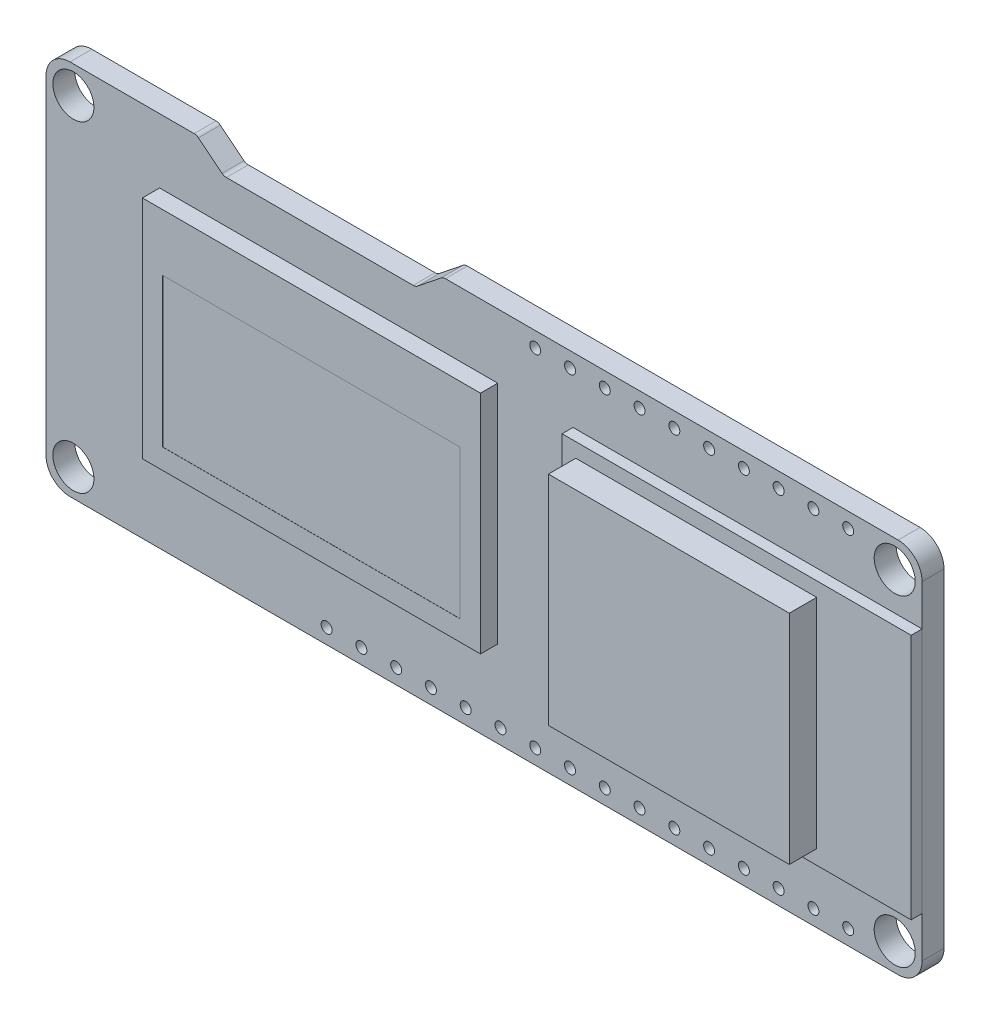
from build123d import *

# Parameters (mm, degrees)
ESQUISSE1_R             = 1.5
ESQUISSE1_R_2           = 0.4
BOSS_EXTRU_1_DEPTH      = 1.6
ESQUISSE2_W             = 25.5
ESQUISSE2_H             = 18
BOSS_EXTRU_2_DEPTH      = 0.8
ESQUISSE3_W             = 17.6
ESQUISSE3_H             = 15.9
BOSS_EXTRU_3_DEPTH      = 2
ESQUISSE4_W             = 24.7
ESQUISSE4_H             = 16.5
BOSS_EXTRU_4_DEPTH      = 1.26
ESQUISSE5_W             = 21.74
ESQUISSE5_H             = 10.86
ENL_V_MAT_EXTRU_1_DEPTH = 0.1
D_PLACER_LA_FACE2_BY    = 0.09
ESQUISSE7_W             = 5.8
ESQUISSE7_H             = 8
BOSS_EXTRU_5_DEPTH      = 2.6
ESQUISSE8_W             = 2.8
ESQUISSE8_H             = 8
BOSS_EXTRU_6_DEPTH      = 0.8
CONG_1_R                = 0.66
ESQUISSE9_W             = 0.5
ESQUISSE9_H             = 4
ENL_V_MAT_EXTRU_2_DEPTH = 5
ESQUISSE10_W            = 3
ESQUISSE10_H            = 4
BOSS_EXTRU_7_DEPTH      = 1.8
ESQUISSE11_R            = 0.9
BOSS_EXTRU_8_DEPTH      = 0.5
BOSS_EXTRU_9_DEPTH      = 2
ESQUISSE12_W            = 11.5
ESQUISSE12_H            = 11
BOSS_EXTRU_9_2_DEPTH    = 2


with BuildPart() as part:
    # Esquisse1 → Boss.-Extru.1 (new body)
    with BuildSketch(Plane.XY):
        with BuildLine():
            Line((-20.863043006, 13.640434405), (-19.136956994, 12.259565595))
            ThreePointArc((-19.136956994, 12.259565595), (-18.990112941, 12.17818584), (-18.82460947, 12.15))
            Line((-18.82460947, 12.15), (-5.17539053, 12.15))
            ThreePointArc((-5.17539053, 12.15), (-5.009887059, 12.17818584), (-4.863043006, 12.259565595))
            Line((-4.863043006, 12.259565595), (-3.136956994, 13.640434405))
            ThreePointArc((-3.136956994, 13.640434405), (-2.990112941, 13.72181416), (-2.82460947, 13.75))
            Line((-2.82460947, 13.75), (30.25, 13.75))
            ThreePointArc((30.25, 13.75), (31.487436867, 13.237436867), (32, 12))
            Line((32, 12), (32, -12))
            ThreePointArc((32, -12), (31.487436867, -13.237436867), (30.25, -13.75))
            Line((30.25, -13.75), (-30.25, -13.75))
            ThreePointArc((-30.25, -13.75), (-31.487436867, -13.237436867), (-32, -12))
            Line((-32, -12), (-32, 12))
            ThreePointArc((-32, 12), (-31.487436867, 13.237436867), (-30.25, 13.75))
            Line((-30.25, 13.75), (-21.17539053, 13.75))
            ThreePointArc((-21.17539053, 13.75), (-21.009887059, 13.72181416), (-20.863043006, 13.640434405))
        make_face()
        with Locations((30, 11.75)):
            Circle(ESQUISSE1_R, mode=Mode.SUBTRACT)
        with Locations((30, -11.75)):
            Circle(ESQUISSE1_R, mode=Mode.SUBTRACT)
        with Locations((-30, -11.75)):
            Circle(ESQUISSE1_R, mode=Mode.SUBTRACT)
        with Locations((-30, 11.75)):
            Circle(ESQUISSE1_R, mode=Mode.SUBTRACT)
        with Locations((26.6, 12.65)):
            Circle(ESQUISSE1_R_2, mode=Mode.SUBTRACT)
        with Locations((24.06, 12.65)):
            Circle(ESQUISSE1_R_2, mode=Mode.SUBTRACT)
        with Locations((21.52, 12.65)):
            Circle(ESQUISSE1_R_2, mode=Mode.SUBTRACT)
        with Locations((18.98, 12.65)):
            Circle(ESQUISSE1_R_2, mode=Mode.SUBTRACT)
        with Locations((16.44, 12.65)):
            Circle(ESQUISSE1_R_2, mode=Mode.SUBTRACT)
        with Locations((13.9, 12.65)):
            Circle(ESQUISSE1_R_2, mode=Mode.SUBTRACT)
        with Locations((11.36, 12.65)):
            Circle(ESQUISSE1_R_2, mode=Mode.SUBTRACT)
        with Locations((8.82, 12.65)):
            Circle(ESQUISSE1_R_2, mode=Mode.SUBTRACT)
        with Locations((6.28, 12.65)):
            Circle(ESQUISSE1_R_2, mode=Mode.SUBTRACT)
        with Locations((3.74, 12.65)):
            Circle(ESQUISSE1_R_2, mode=Mode.SUBTRACT)
        with Locations(Location((26.6, -12.65, 0), (0, 0, 180))):
            Circle(ESQUISSE1_R_2, mode=Mode.SUBTRACT)
        with Locations(Location((24.06, -12.65, 0), (0, 0, 180))):
            Circle(ESQUISSE1_R_2, mode=Mode.SUBTRACT)
        with Locations(Location((21.52, -12.65, 0), (0, 0, 180))):
            Circle(ESQUISSE1_R_2, mode=Mode.SUBTRACT)
        with Locations(Location((18.98, -12.65, 0), (0, 0, 180))):
            Circle(ESQUISSE1_R_2, mode=Mode.SUBTRACT)
        with Locations(Location((16.44, -12.65, 0), (0, 0, 180))):
            Circle(ESQUISSE1_R_2, mode=Mode.SUBTRACT)
        with Locations(Location((13.9, -12.65, 0), (0, 0, 180))):
            Circle(ESQUISSE1_R_2, mode=Mode.SUBTRACT)
        with Locations(Location((11.36, -12.65, 0), (0, 0, 180))):
            Circle(ESQUISSE1_R_2, mode=Mode.SUBTRACT)
        with Locations(Location((8.82, -12.65, 0), (0, 0, 180))):
            Circle(ESQUISSE1_R_2, mode=Mode.SUBTRACT)
        with Locations(Location((6.28, -12.65, 0), (0, 0, 180))):
            Circle(ESQUISSE1_R_2, mode=Mode.SUBTRACT)
        with Locations(Location((3.74, -12.65, 0), (0, 0, 180))):
            Circle(ESQUISSE1_R_2, mode=Mode.SUBTRACT)
        with Locations(Location((1.2, -12.65, 0), (0, 0, 180))):
            Circle(ESQUISSE1_R_2, mode=Mode.SUBTRACT)
        with Locations(Location((-1.34, -12.65, 0), (0, 0, 180))):
            Circle(ESQUISSE1_R_2, mode=Mode.SUBTRACT)
        with Locations(Location((-3.88, -12.65, 0), (0, 0, 180))):
            Circle(ESQUISSE1_R_2, mode=Mode.SUBTRACT)
        with Locations(Location((-6.42, -12.65, 0), (0, 0, 180))):
            Circle(ESQUISSE1_R_2, mode=Mode.SUBTRACT)
        with Locations(Location((-8.96, -12.65, 0), (0, 0, 180))):
            Circle(ESQUISSE1_R_2, mode=Mode.SUBTRACT)
        with Locations(Location((-11.5, -12.65, 0), (0, 0, 180))):
            Circle(ESQUISSE1_R_2, mode=Mode.SUBTRACT)
    extrude(amount=-BOSS_EXTRU_1_DEPTH)

    # Esquisse7 → Boss.-Extru.5 (add)
    with BuildSketch(Plane(origin=(0, 0, -1.6), x_dir=(-1, 0, 0), z_dir=(0, 0, -1))):
        with Locations((29.1, -4.55)):
            Rectangle(ESQUISSE7_W, ESQUISSE7_H)
    extrude(amount=BOSS_EXTRU_5_DEPTH)

    # Esquisse8 → Boss.-Extru.6 (add)
    with BuildSketch(Plane.ZY.offset(32)):
        with Locations((-2.8, -4.55)):
            Rectangle(ESQUISSE8_W, ESQUISSE8_H)
    extrude(amount=BOSS_EXTRU_6_DEPTH)

    # Congé1
    cong_1_edges = [part.edges().sort_by_distance(p)[0] for p in [
        (-29.5, -0.55, -4.2),
        (-29.5, -8.55, -4.2),
    ]]
    fillet(cong_1_edges, radius=CONG_1_R)

    # Chanfrein1
    # the kernel refuses this chamfer: 1 mm, written as the material it takes off along each edge
    with BuildSketch(Plane(origin=(-25.827960829, -0.55, -1.4), x_dir=(0, -0.9996219169112968, 0.027495876610586282), z_dir=(-1, 0, 0))) as chanfrein1_piece_1_section:
        with BuildLine():
            Line((1.028673195, 0), (-0.056547155, -1.027117794))
            Line((-0.056547155, -1.027117794), (-0.076539593, -1.026567876))
            ThreePointArc((-0.076539593, -1.026567876), (-0.034129227, -0.51339783), (-0.019992438, 0.000549918))
            Line((-0.019992438, 0.000549918), (0.000549918, 0.019992438))
            ThreePointArc((0.000549918, 0.019992438), (0.514497665, 0.00585565), (1.029223113, 0.019992438))
            Line((1.029223113, 0.019992438), (1.028673195, 0))
        make_face()
    chanfrein1_piece_1 = extrude(amount=13.144078342, mode=Mode.PRIVATE)
    chanfrein1_piece_1 = split(chanfrein1_piece_1, bisect_by=Plane(origin=(-32, -0.79899688, -1.880740252), z_dir=(1, 0, 0)), keep=Keep.TOP, mode=Mode.PRIVATE)
    chanfrein1_piece_1 = split(chanfrein1_piece_1, bisect_by=Plane(origin=(-28.913980414, -0.79899688, -1.6), z_dir=(0, 0, -1)), keep=Keep.TOP, mode=Mode.PRIVATE)
    add(chanfrein1_piece_1, mode=Mode.SUBTRACT)
    with BuildSketch(Plane(origin=(-32, -0.55, -1.4), x_dir=(0, -0.9996219169112968, 0.027495876610586282), z_dir=(-1, 0, 0))) as chanfrein1_piece_2_section:
        with BuildLine():
            Line((1.028673195, 0), (-0.056547155, -1.027117794))
            Line((-0.056547155, -1.027117794), (-0.076539593, -1.026567876))
            ThreePointArc((-0.076539593, -1.026567876), (-0.034129227, -0.51339783), (-0.019992438, 0.000549918))
            Line((-0.019992438, 0.000549918), (0.000549918, 0.019992438))
            ThreePointArc((0.000549918, 0.019992438), (0.514497665, 0.00585565), (1.029223113, 0.019992438))
            Line((1.029223113, 0.019992438), (1.028673195, 0))
        make_face()
    chanfrein1_piece_2 = extrude(amount=6.972039171, mode=Mode.PRIVATE)
    chanfrein1_piece_2 = split(chanfrein1_piece_2, bisect_by=Plane(origin=(-35.486019586, -1.011905027, -1.6), z_dir=(0, 0, 1)), keep=Keep.TOP, mode=Mode.PRIVATE)
    add(chanfrein1_piece_2, mode=Mode.SUBTRACT)
    with BuildSketch(Plane(origin=(-32, -0.55, -1.4), x_dir=(0, -0.9996219169112968, 0.027495876610586282), z_dir=(-1, 0, 0))) as chanfrein1_piece_3_section:
        with BuildLine():
            Line((1.028673195, 0), (-0.056547155, -1.027117794))
            Line((-0.056547155, -1.027117794), (-0.076539593, -1.026567876))
            ThreePointArc((-0.076539593, -1.026567876), (-0.034129227, -0.51339783), (-0.019992438, 0.000549918))
            Line((-0.019992438, 0.000549918), (0.000549918, 0.019992438))
            ThreePointArc((0.000549918, 0.019992438), (0.514497665, 0.00585565), (1.029223113, 0.019992438))
            Line((1.029223113, 0.019992438), (1.028673195, 0))
        make_face()
    chanfrein1_piece_3 = extrude(amount=6.972039171, mode=Mode.PRIVATE)
    chanfrein1_piece_3 = split(chanfrein1_piece_3, bisect_by=Plane(origin=(-35.486019586, -0.79899688, -1.6), z_dir=(0, 0, -1)), keep=Keep.TOP, mode=Mode.PRIVATE)
    add(chanfrein1_piece_3, mode=Mode.SUBTRACT)
    with BuildSketch(Plane(origin=(-25.827960829, -8.55, -1.4), x_dir=(0, -0.02749587661058563, -0.9996219169112968), z_dir=(-1, 0, 0))) as chanfrein1_piece_4_section:
        with BuildLine():
            Line((1.028673195, 0), (-0.056547155, -1.027117794))
            Line((-0.056547155, -1.027117794), (-0.076539593, -1.026567876))
            ThreePointArc((-0.076539593, -1.026567876), (-0.034129227, -0.51339783), (-0.019992438, 0.000549918))
            Line((-0.019992438, 0.000549918), (0.000549918, 0.019992438))
            ThreePointArc((0.000549918, 0.019992438), (0.514497665, 0.00585565), (1.029223113, 0.019992438))
            Line((1.029223113, 0.019992438), (1.028673195, 0))
        make_face()
    chanfrein1_piece_4 = extrude(amount=13.144078342, mode=Mode.PRIVATE)
    chanfrein1_piece_4 = split(chanfrein1_piece_4, bisect_by=Plane(origin=(-32, -8.30100312, -1.880740252), z_dir=(1, 0, 0)), keep=Keep.TOP, mode=Mode.PRIVATE)
    chanfrein1_piece_4 = split(chanfrein1_piece_4, bisect_by=Plane(origin=(-28.913980414, -8.30100312, -1.6), z_dir=(0, 0, -1)), keep=Keep.TOP, mode=Mode.PRIVATE)
    add(chanfrein1_piece_4, mode=Mode.SUBTRACT)
    with BuildSketch(Plane(origin=(-32, -8.55, -1.4), x_dir=(0, -0.02749587661058563, -0.9996219169112968), z_dir=(-1, 0, 0))) as chanfrein1_piece_5_section:
        with BuildLine():
            Line((1.028673195, 0), (-0.056547155, -1.027117794))
            Line((-0.056547155, -1.027117794), (-0.076539593, -1.026567876))
            ThreePointArc((-0.076539593, -1.026567876), (-0.034129227, -0.51339783), (-0.019992438, 0.000549918))
            Line((-0.019992438, 0.000549918), (0.000549918, 0.019992438))
            ThreePointArc((0.000549918, 0.019992438), (0.514497665, 0.00585565), (1.029223113, 0.019992438))
            Line((1.029223113, 0.019992438), (1.028673195, 0))
        make_face()
    chanfrein1_piece_5 = extrude(amount=6.972039171, mode=Mode.PRIVATE)
    chanfrein1_piece_5 = split(chanfrein1_piece_5, bisect_by=Plane(origin=(-35.486019586, -8.30100312, -1.6), z_dir=(0, 0, -1)), keep=Keep.TOP, mode=Mode.PRIVATE)
    add(chanfrein1_piece_5, mode=Mode.SUBTRACT)
    with BuildSketch(Plane(origin=(-32, -8.55, -1.4), x_dir=(0, -0.02749587661058563, -0.9996219169112968), z_dir=(-1, 0, 0))) as chanfrein1_piece_6_section:
        with BuildLine():
            Line((1.028673195, 0), (-0.056547155, -1.027117794))
            Line((-0.056547155, -1.027117794), (-0.076539593, -1.026567876))
            ThreePointArc((-0.076539593, -1.026567876), (-0.034129227, -0.51339783), (-0.019992438, 0.000549918))
            Line((-0.019992438, 0.000549918), (0.000549918, 0.019992438))
            ThreePointArc((0.000549918, 0.019992438), (0.514497665, 0.00585565), (1.029223113, 0.019992438))
            Line((1.029223113, 0.019992438), (1.028673195, 0))
        make_face()
    chanfrein1_piece_6 = extrude(amount=6.972039171, mode=Mode.PRIVATE)
    chanfrein1_piece_6 = split(chanfrein1_piece_6, bisect_by=Plane(origin=(-35.486019586, -8.088094973, -1.6), z_dir=(0, 0, 1)), keep=Keep.TOP, mode=Mode.PRIVATE)
    add(chanfrein1_piece_6, mode=Mode.SUBTRACT)

    # Esquisse9 → Enlèv. mat.-Extru.2 (cut)
    with BuildSketch(Plane.ZY.offset(32.8)):
        with BuildLine():
            Line((-1.73, -7.413309524), (-1.73, -1.686690476))
            Line((-1.73, -1.686690476), (-2.536690476, -0.88))
            Line((-2.536690476, -0.88), (-3.54, -0.88))
            ThreePointArc((-3.54, -0.88), (-3.773345238, -0.976654762), (-3.87, -1.21))
            Line((-3.87, -1.21), (-3.87, -7.89))
            ThreePointArc((-3.87, -7.89), (-3.773345238, -8.123345238), (-3.54, -8.22))
            Line((-3.54, -8.22), (-2.536690476, -8.22))
            Line((-2.536690476, -8.22), (-1.73, -7.413309524))
        make_face()
        with Locations((-2.8, -4.55)):
            Rectangle(ESQUISSE9_W, ESQUISSE9_H, mode=Mode.SUBTRACT)
    extrude(amount=-ENL_V_MAT_EXTRU_2_DEPTH, mode=Mode.SUBTRACT)

    # Esquisse10 → Boss.-Extru.7 (add)
    with BuildSketch(Plane(origin=(0, 0, -1.6), x_dir=(-1, 0, 0), z_dir=(0, 0, -1))):
        with Locations((29.9, 5.55)):
            Rectangle(ESQUISSE10_W, ESQUISSE10_H)
        with Locations((25.6, 5.55)):
            Rectangle(ESQUISSE10_W, ESQUISSE10_H)
    extrude(amount=BOSS_EXTRU_7_DEPTH)

    # Esquisse11 → Boss.-Extru.8 (add)
    with BuildSketch(Plane(origin=(0, 0, -3.4), x_dir=(-1, 0, 0), z_dir=(0, 0, -1))):
        with Locations((25.6, 5.55)):
            Circle(ESQUISSE11_R)
        with Locations((29.9, 5.55)):
            Circle(ESQUISSE11_R)
    extrude(amount=BOSS_EXTRU_8_DEPTH)


with BuildPart() as body_2:
    # Esquisse2 → Boss.-Extru.2 (new body)
    with BuildSketch(Plane.XY):
        with Locations((19.25, 0)):
            Rectangle(ESQUISSE2_W, ESQUISSE2_H)
    extrude(amount=BOSS_EXTRU_2_DEPTH)

    # Esquisse3 → Boss.-Extru.3 (add)
    with BuildSketch(Plane.XY.offset(0.8)):
        with Locations((16.3, 0)):
            Rectangle(ESQUISSE3_W, ESQUISSE3_H)
    extrude(amount=BOSS_EXTRU_3_DEPTH)


with BuildPart() as body_3:
    # Esquisse4 → Boss.-Extru.4 (new body)
    with BuildSketch(Plane.XY):
        with Locations((-11.35, 0.8)):
            Rectangle(ESQUISSE4_W, ESQUISSE4_H)
    extrude(amount=BOSS_EXTRU_4_DEPTH)

    # Esquisse5 → Enlèv. mat.-Extru.1 (cut)
    with BuildSketch(Plane.XY.offset(1.26)):
        with Locations((-11.35, -0.54)):
            Rectangle(ESQUISSE5_W, ESQUISSE5_H)
    extrude(amount=-ENL_V_MAT_EXTRU_1_DEPTH, mode=Mode.SUBTRACT)

    # Déplacer la face2: a face moved outward by 0.09
    extrude(body_3.faces().sort_by_distance((-11.35, -0.54, 1.16))[0], amount=D_PLACER_LA_FACE2_BY, dir=(0, 0, 1))


with BuildPart() as body_4:
    # Esquisse12 → Boss.-Extru.9 (new body)
    with BuildSketch(Plane(origin=(0, 0, -1.6), x_dir=(-1, 0, 0), z_dir=(0, 0, -1))):
        Polygon((-3.5, 8.05), (-3.5, -11.25), (14.4, -11.25), (14.4, -13.75), (26, -13.75), (26, -9.75), (24.4, -9.75), (24.4, 2.05), (22.76436437, 2.05), (22.76436437, 8.05), align=None)
    extrude(amount=BOSS_EXTRU_9_DEPTH)


with BuildPart() as body_5:
    # Esquisse12 → Boss.-Extru.9 2 (new body)
    with BuildSketch(Plane(origin=(0, 0, -1.6), x_dir=(-1, 0, 0), z_dir=(0, 0, -1))):
        with Locations((-19.75, 1.55)):
            Rectangle(ESQUISSE12_W, ESQUISSE12_H)
    extrude(amount=BOSS_EXTRU_9_2_DEPTH)


solid = Compound([part.part, body_2.part, body_3.part, body_4.part, body_5.part])
